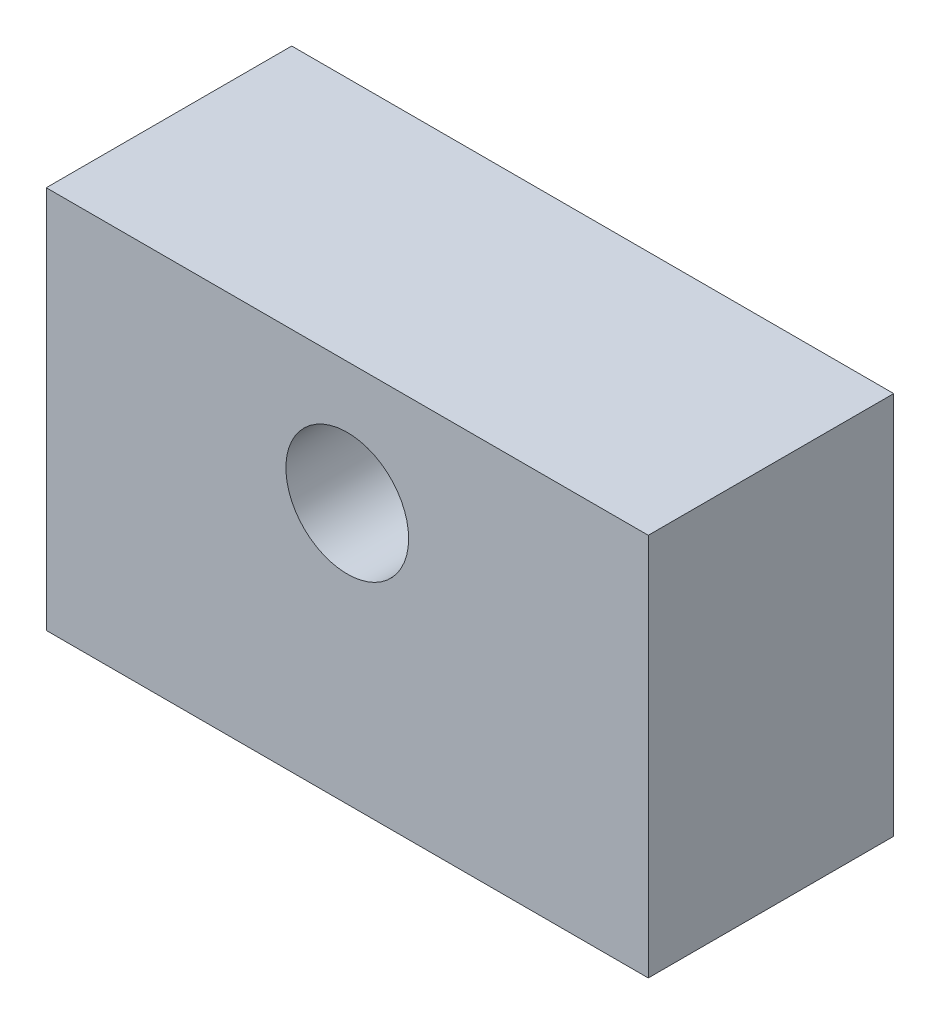
from build123d import *
from build123d.topology import SkipClean

# Parameters (mm, degrees)
SKETCH3_W                      = 31.148374891
SKETCH3_H                      = 19.837641971
BOSS_EXTRUDE1_DEPTH            = 6.35
SKETCH4_R                      = 3.175
CUT_EXTRUDE1_DEPTH             = 9.525
SKETCH5_R                      = 3.175
CUT_EXTRUDE5_DEPTH             = 9.525
CUT_EXTRUDE5_DIRECTION_2_REACH = 33.299
SKETCH6_R                      = 3.175
CUT_EXTRUDE6_DEPTH             = 9.525


with BuildPart() as part:
    # Sketch3 → Boss-Extrude1 (new, symmetric)
    with BuildSketch(Plane.XY):
        with Locations((15.574187446, -9.918820986)):
            Rectangle(SKETCH3_W, SKETCH3_H)
    extrude(amount=BOSS_EXTRUDE1_DEPTH, both=True)

    # Sketch4 → Cut-Extrude1 (cut)
    with BuildSketch(Plane.ZY):
        with Locations((0, -6.35)):
            Circle(SKETCH4_R)
    extrude(amount=-CUT_EXTRUDE1_DEPTH, mode=Mode.SUBTRACT)

    # Sketch5 → Cut-Extrude5 (cut)
    with BuildSketch(Plane(origin=(7.787093723, -19.837641971, 0), x_dir=(-0.8660254037844382, 0.500000000000001, 0), z_dir=(-0.500000000000001, -0.8660254037844382, 0))):
        Circle(SKETCH5_R)
    cut_extrude5 = extrude(amount=-CUT_EXTRUDE5_DEPTH, mode=Mode.SUBTRACT)

    # Sketch5 → Cut-Extrude5 direction 2 (cut, up to next)
    with BuildSketch(Plane(origin=(7.787093723, -19.837641971, 0), x_dir=(-0.8660254037844382, 0.500000000000001, 0), z_dir=(-0.500000000000001, -0.8660254037844382, 0)), mode=Mode.PRIVATE) as cut_extrude5_direction_2_sk1:
        Circle(SKETCH5_R)
    cut_extrude5_direction_2_tool1 = extrude(cut_extrude5_direction_2_sk1.sketch, amount=CUT_EXTRUDE5_DIRECTION_2_REACH, mode=Mode.PRIVATE) & part.part
    cut_extrude5_direction_2 = cut_extrude5_direction_2_tool1.solids().sort_by_distance((7.787094, -19.837642, 0))[0]
    add(cut_extrude5_direction_2, mode=Mode.SUBTRACT)

    # Sketch6 → Cut-Extrude6 (cut)
    with BuildSketch(Plane(origin=(0, 0, 6.35), x_dir=(-1, 0, 0), z_dir=(0, 0, -1))):
        with Locations((-15.574187445, -6.35)):
            Circle(SKETCH6_R)
    extrude(amount=CUT_EXTRUDE6_DEPTH, mode=Mode.SUBTRACT)

    # Mirror1: Cut-Extrude5, Cut-Extrude5 direction 2 across plane
    with SkipClean():  # the faces are left unmerged after this step: merging them gives an invalid solid
        add(cut_extrude5.mirror(Plane.ZY.offset(-15.574187445)), mode=Mode.SUBTRACT)
        add(cut_extrude5_direction_2.mirror(Plane.ZY.offset(-15.574187445)), mode=Mode.SUBTRACT)


solid = part.part
